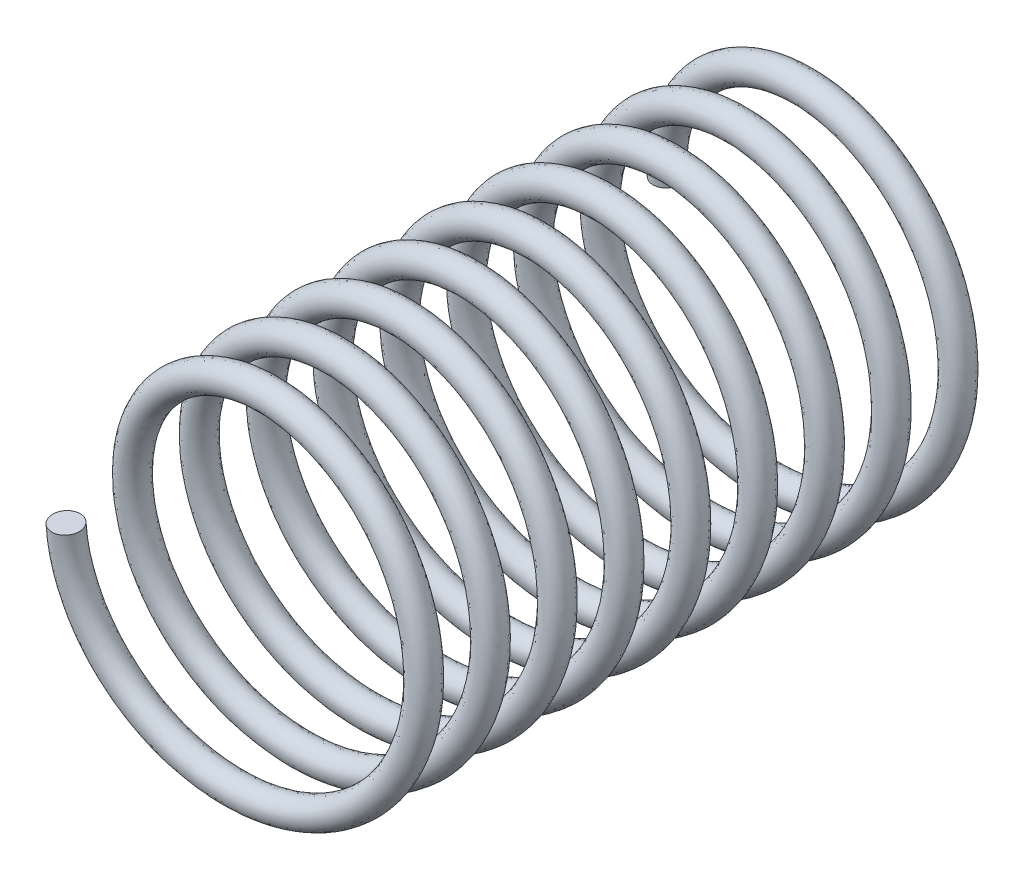
from build123d import *

# Parameters (mm, degrees)
SWEEP_1_PITCH       = 3.3
SWEEP_1_HEIGHT      = 29.7
SWEEP_1_RADIUS      = 8
SWEEP_1_START_ANGLE = -180
SKETCH_2_R          = 0.7


with BuildPart() as part:
    # 扫描1: sweep along a helix
    with BuildLine() as sweep_1_path:
        add(Helix(SWEEP_1_PITCH, SWEEP_1_HEIGHT, SWEEP_1_RADIUS, center=(-4.758542759, 12.579514026, 0), direction=(0, 0, 1), lefthand=True, mode=Mode.PRIVATE).rotate(Axis((-4.758542759, 12.579514026, 0), (0, 0, 1)), SWEEP_1_START_ANGLE))
    # 草图2 → 扫描1 (sweep)
    with BuildSketch(Plane(origin=(-12.758542759, 12.579514026, 0), x_dir=(1, 0, 0), z_dir=(-8.318017335505708e-15, 0.9978518873778073, 0.06551038739427384))):
        Circle(SKETCH_2_R)
    sweep(path=sweep_1_path.line, is_frenet=True)


solid = part.part
